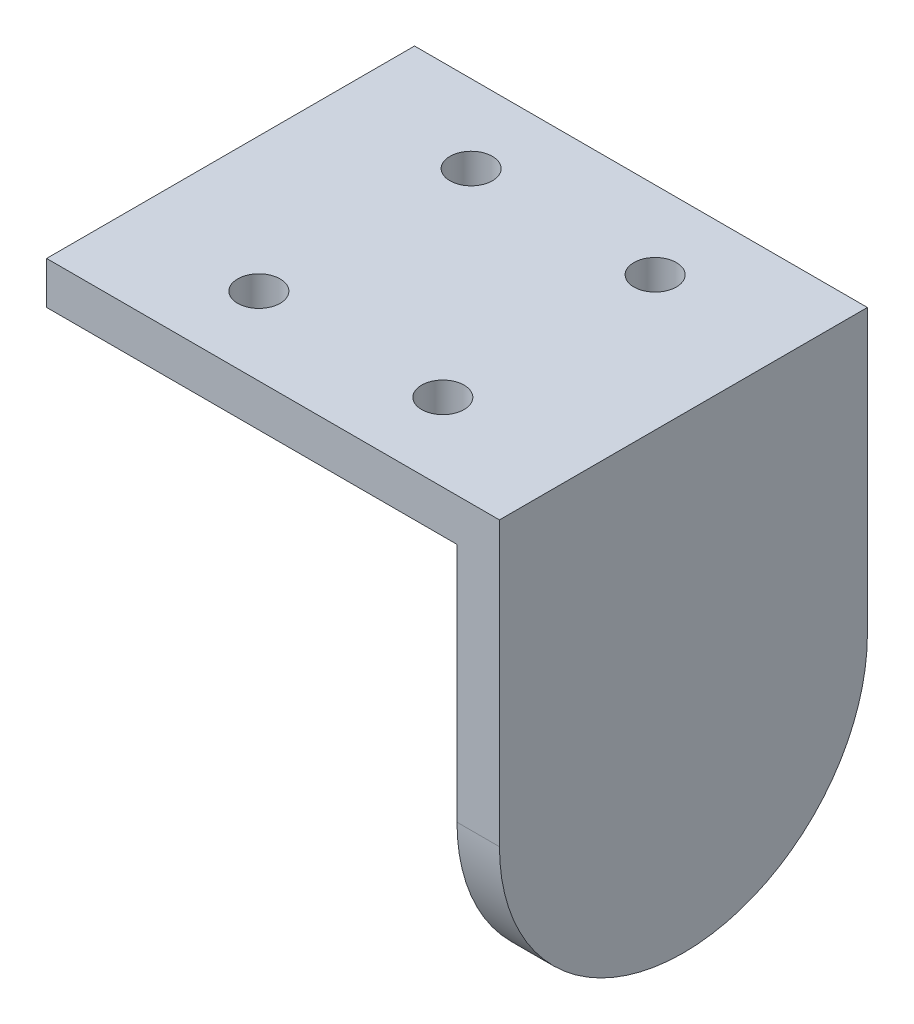
from build123d import *

# Parameters (mm, degrees)
BOSS_EXTRUDE1_DEPTH = 26
FILLET1_R           = 13
CUT_EXTRUDE1_REACH  = 53.049
SKETCH2_R           = 1.5


with BuildPart() as part:
    # Sketch1 → Boss-Extrude1 (new body)
    with BuildSketch(Plane.XY):
        Polygon((0, 0), (3, 0), (3, 33), (-29, 33), (-29, 30), (0, 30), align=None)
    extrude(amount=BOSS_EXTRUDE1_DEPTH)

    # Fillet1
    fillet1_edges = [part.edges().sort_by_distance(p)[0] for p in [
        (1.5, 0, 0),
        (1.5, 0, 26),
    ]]
    fillet(fillet1_edges, radius=FILLET1_R - 0.0001)  # a hair under: the kernel refuses the full size

    # Sketch2 → Cut-Extrude1 (cut, up to next)
    with BuildSketch(Plane(origin=(0, 33, 0), x_dir=(1, 0, 0), z_dir=(0, 1, 0)), mode=Mode.PRIVATE) as cut_extrude1_sk1:
        with Locations(Location((-19.5, -5.5, 0), (0, 0, 270))):
            Circle(SKETCH2_R)
    cut_extrude1_tool1 = extrude(cut_extrude1_sk1.sketch, amount=-CUT_EXTRUDE1_REACH, mode=Mode.PRIVATE) & part.part
    # Sketch2 → Cut-Extrude1 (cut, up to next)
    with BuildSketch(Plane(origin=(0, 33, 0), x_dir=(1, 0, 0), z_dir=(0, 1, 0)), mode=Mode.PRIVATE) as cut_extrude1_sk2:
        with Locations(Location((-19.5, -20.5, 0), (0, 0, 270))):
            Circle(SKETCH2_R)
    cut_extrude1_tool2 = extrude(cut_extrude1_sk2.sketch, amount=-CUT_EXTRUDE1_REACH, mode=Mode.PRIVATE) & part.part
    # Sketch2 → Cut-Extrude1 (cut, up to next)
    with BuildSketch(Plane(origin=(0, 33, 0), x_dir=(1, 0, 0), z_dir=(0, 1, 0)), mode=Mode.PRIVATE) as cut_extrude1_sk3:
        with Locations(Location((-6.5, -5.5, 0), (0, 0, 270))):
            Circle(SKETCH2_R)
    cut_extrude1_tool3 = extrude(cut_extrude1_sk3.sketch, amount=-CUT_EXTRUDE1_REACH, mode=Mode.PRIVATE) & part.part
    # Sketch2 → Cut-Extrude1 (cut, up to next)
    with BuildSketch(Plane(origin=(0, 33, 0), x_dir=(1, 0, 0), z_dir=(0, 1, 0)), mode=Mode.PRIVATE) as cut_extrude1_sk4:
        with Locations(Location((-6.5, -20.5, 0), (0, 0, 270))):
            Circle(SKETCH2_R)
    cut_extrude1_tool4 = extrude(cut_extrude1_sk4.sketch, amount=-CUT_EXTRUDE1_REACH, mode=Mode.PRIVATE) & part.part
    add(cut_extrude1_tool1.solids().sort_by_distance((-19.5, 33, 5.5))[0], mode=Mode.SUBTRACT)
    add(cut_extrude1_tool2.solids().sort_by_distance((-19.5, 33, 20.5))[0], mode=Mode.SUBTRACT)
    add(cut_extrude1_tool3.solids().sort_by_distance((-6.5, 33, 5.5))[0], mode=Mode.SUBTRACT)
    add(cut_extrude1_tool4.solids().sort_by_distance((-6.5, 33, 20.5))[0], mode=Mode.SUBTRACT)


solid = part.part
